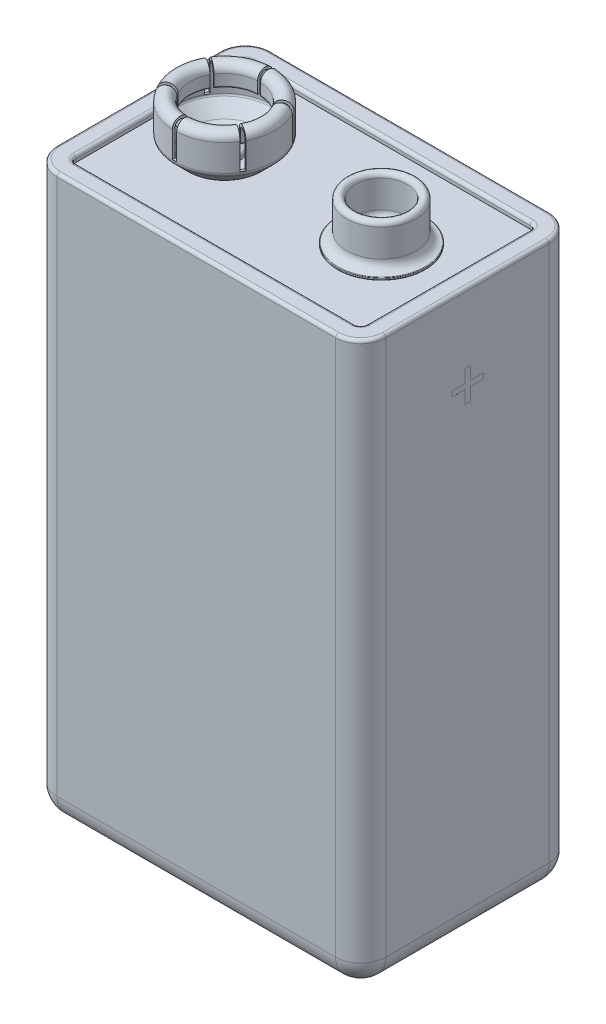
from build123d import *

# Parameters (mm, degrees)
GRUNDK_RPER_SKIZZE_W                          = 26.2
GRUNDK_RPER_SKIZZE_H                          = 17
GRUNDK_RPER_AUFSATZ_AUSTRAGEN_DEPTH           = 22.5
GRUNDK_RPER_VERRUNDUNG_R                      = 2
VERTIEFUNG_ANSCHL_SSE_SCHNITT_AUSTRAGEN_DEPTH = 0.5
VERTIEFUNG_ANSCHL_SSE_VERRUNDUNG_R            = 0.25
ANSCHLUSS_MINUSPOL_ROTATION_ANGLE             = 55
ANSCHLUSS_MINUSPOL_KREISMUSTER_COUNT          = 6
BESCHRIFTUNG_PLUSPOL_SCHNITT_AUSTRAGEN_DEPTH  = 0.001
BESCHRIFTUNG_MINUSPOL_SKIZZE_W                = 2.333333333
BESCHRIFTUNG_MINUSPOL_SKIZZE_H                = 0.358974358
BESCHRIFTUNG_MINUSPOL_SCHNITT_AUSTRAGEN_DEPTH = 0.001


with BuildPart() as part:
    # Grundkörper_Skizze → Grundkörper_Aufsatz austragen (new, symmetric)
    with BuildSketch(Plane(origin=(0, 0, 0), x_dir=(1, 0, 0), z_dir=(0, 1, 0))):
        Rectangle(GRUNDK_RPER_SKIZZE_W, GRUNDK_RPER_SKIZZE_H)
    extrude(amount=GRUNDK_RPER_AUFSATZ_AUSTRAGEN_DEPTH, both=True)

    # Grundkörper_Verrundung
    grundk_rper_verrundung_edges = [part.edges().sort_by_distance(p)[0] for p in [
        (0, -22.5, -8.5),
        (13.1, -22.5, 0),
        (0, -22.5, 8.5),
        (-13.1, -22.5, 0),
        (-13.1, 0, -8.5),
        (13.1, 0, -8.5),
        (13.1, 0, 8.5),
        (-13.1, 0, 8.5),
    ]]
    fillet(grundk_rper_verrundung_edges, radius=GRUNDK_RPER_VERRUNDUNG_R)

    # Vertiefung Anschlüsse_Skizze → Vertiefung Anschlüsse_Schnitt austragen (cut)
    with BuildSketch(Plane(origin=(0, 22.5, 0), x_dir=(1, 0, 0), z_dir=(0, 1, 0))):
        with BuildLine():
            Line((11.6, -6.5), (11.6, 6.5))
            ThreePointArc((11.6, 6.5), (11.453553391, 6.853553391), (11.1, 7))
            Line((11.1, 7), (-11.1, 7))
            ThreePointArc((-11.1, 7), (-11.453553391, 6.853553391), (-11.6, 6.5))
            Line((-11.6, 6.5), (-11.6, -6.5))
            ThreePointArc((-11.6, -6.5), (-11.453553391, -6.853553391), (-11.1, -7))
            Line((-11.1, -7), (11.1, -7))
            ThreePointArc((11.1, -7), (11.453553391, -6.853553391), (11.6, -6.5))
        make_face()
    extrude(amount=-VERTIEFUNG_ANSCHL_SSE_SCHNITT_AUSTRAGEN_DEPTH, mode=Mode.SUBTRACT)

    # Vertiefung Anschlüsse_Verrundung
    vertiefung_anschl_sse_verrundung_edges = [part.edges().sort_by_distance(p)[0] for p in [
        (0, 22.5, 8.5),
        (13.1, 22.5, 0),
        (0, 22.5, -8.5),
        (-13.1, 22.5, 0),
        (-12.514213562, 22.5, 7.914213562),
        (12.514213562, 22.5, 7.914213562),
        (-12.514213562, 22.5, -7.914213562),
        (12.514213562, 22.5, -7.914213562),
        (11.453553391, 22.5, 6.853553391),
        (11.6, 22.5, 0),
        (11.453553391, 22.5, -6.853553391),
        (0, 22.5, -7),
        (-11.453553391, 22.5, -6.853553391),
        (-11.6, 22.5, 0),
        (-11.453553391, 22.5, 6.853553391),
        (0, 22.5, 7),
    ]]
    fillet(vertiefung_anschl_sse_verrundung_edges, radius=VERTIEFUNG_ANSCHL_SSE_VERRUNDUNG_R)

    # Anschlüsse_Skizze → Anschluss Pluspol_Rotation (revolve)
    with BuildSketch(Plane.XY, mode=Mode.PRIVATE) as anschluss_pluspol_rotation_sk:
        with BuildLine():
            Line((9.75, 22.05), (9.75, 22.151564029))
            ThreePointArc((9.75, 22.151564029), (9.736443449, 22.185796689), (9.703125, 22.201466277))
            ThreePointArc((9.703125, 22.201466277), (9.20334826, 22.436510102), (9, 22.95))
            Line((9, 22.95), (9, 25.15))
            ThreePointArc((9, 25.15), (8.65, 25.5), (8.3, 25.15))
            Line((8.3, 25.15), (8.3, 22.95))
            ThreePointArc((8.3, 22.95), (8.153553391, 22.596446609), (7.8, 22.45))
            Line((7.8, 22.45), (7.5, 22.45))
            ThreePointArc((7.5, 22.45), (7.426776695, 22.626776695), (7.25, 22.7))
            Line((7.25, 22.7), (6.65, 22.7))
            ThreePointArc((6.65, 22.7), (6.473223305, 22.626776695), (6.4, 22.45))
            ThreePointArc((6.4, 22.45), (6.356066017, 22.343933983), (6.25, 22.3))
            Line((6.25, 22.3), (6.25, 22))
            Line((6.25, 22), (9.7, 22))
            ThreePointArc((9.7, 22), (9.735355339, 22.014644661), (9.75, 22.05))
        make_face()
    revolve(anschluss_pluspol_rotation_sk.sketch.rotate(Axis((6.25, 22, 0), (0, 1, 0)), 90), axis=Axis((6.25, 22, 0), (0, 1, 0)))

    # Anschluss Pluspol_Skizze<3> → Anschluss Minuspol Basis_Rotation (revolve)
    with BuildSketch(Plane.XY, mode=Mode.PRIVATE) as anschluss_minuspol_basis_rotation_sk:
        with BuildLine():
            Line((-7.5, 22.2), (-8.5, 22.2))
            ThreePointArc((-8.5, 22.2), (-8.806146746, 22.260896374), (-9.065685425, 22.434314575))
            Line((-9.065685425, 22.434314575), (-9.99246212, 23.36109127))
            ThreePointArc((-9.99246212, 23.36109127), (-10.035046392, 23.424823137), (-10.05, 23.5))
            Line((-10.05, 23.5), (-10.05, 23.55))
            Line((-10.05, 23.55), (-10.25, 23.55))
            Line((-10.25, 23.55), (-10.25, 23.5))
            ThreePointArc((-10.25, 23.5), (-10.219822299, 23.348286451), (-10.133883476, 23.219669914))
            Line((-10.133883476, 23.219669914), (-9.207106781, 22.292893219))
            ThreePointArc((-9.207106781, 22.292893219), (-8.882683432, 22.076120467), (-8.5, 22))
            Line((-8.5, 22), (-6.25, 22))
            Line((-6.25, 22), (-6.25, 22.3))
            ThreePointArc((-6.25, 22.3), (-6.356066017, 22.343933983), (-6.4, 22.45))
            ThreePointArc((-6.4, 22.45), (-6.473223305, 22.626776695), (-6.65, 22.7))
            Line((-6.65, 22.7), (-7.25, 22.7))
            ThreePointArc((-7.25, 22.7), (-7.426776695, 22.626776695), (-7.5, 22.45))
            Line((-7.5, 22.45), (-7.5, 22.2))
        make_face()
    revolve(anschluss_minuspol_basis_rotation_sk.sketch.rotate(Axis((-6.25, 22, 0), (0, 1, 0)), 270), axis=Axis((-6.25, 22, 0), (0, 1, 0)))


with BuildPart() as body_2:
    # Anschluss Minuspol_Skizze → Anschluss Minuspol_Rotation (revolve, symmetric)
    with BuildSketch(Plane.XY) as anschluss_minuspol_rotation_sk:
        with BuildLine():
            Line((-10.25, 23.55), (-10.05, 23.55))
            Line((-10.05, 23.55), (-10.05, 25.625))
            ThreePointArc((-10.05, 25.625), (-9.625, 26.05), (-9.2, 25.625))
            Line((-9.2, 25.625), (-9.2, 24.75))
            ThreePointArc((-9.2, 24.75), (-9.1, 24.65), (-9, 24.75))
            Line((-9, 24.75), (-9, 25.625))
            ThreePointArc((-9, 25.625), (-9.625, 26.25), (-10.25, 25.625))
            Line((-10.25, 25.625), (-10.25, 23.55))
        make_face()
    anschluss_minuspol_rotation = revolve(axis=Axis((-6.25, 25.625, 0), (0, 1, 0)), revolution_arc=ANSCHLUSS_MINUSPOL_ROTATION_ANGLE / 2)
    anschluss_minuspol_rotation = anschluss_minuspol_rotation + revolve(anschluss_minuspol_rotation_sk.sketch, axis=Axis((-6.25, 25.625, 0), (0, -1, 0)), revolution_arc=ANSCHLUSS_MINUSPOL_ROTATION_ANGLE / 2)


with BuildPart() as part_1:
    add(part.part)

    # Anschluss Minuspol_Kreismuster: Anschluss Minuspol_Rotation ×6 about axis
    anschluss_minuspol_kreismuster_axis = Axis((-6.25, 0, 0), (0, 1, 0))
    for i in range(1, ANSCHLUSS_MINUSPOL_KREISMUSTER_COUNT):
        add(anschluss_minuspol_rotation.rotate(anschluss_minuspol_kreismuster_axis, i * 360 / ANSCHLUSS_MINUSPOL_KREISMUSTER_COUNT))

    # Beschriftung Pluspol_Skizze → Beschriftung Pluspol_Schnitt austragen (cut)
    with BuildSketch(Plane(origin=(13.1, 0, 0), x_dir=(0, 0, -1), z_dir=(1, 0, 0))):
        Polygon((-0.179487179, 15.525641026), (-0.179487179, 14.493589744), (0.269230769, 14.493589744), (0.269230769, 15.525641026), (1.301282051, 15.525641026), (1.301282051, 15.929487179), (0.269230769, 15.929487179), (0.269230769, 16.961538462), (-0.179487179, 16.961538462), (-0.179487179, 15.929487179), (-1.211538462, 15.929487179), (-1.211538462, 15.525641026), align=None)
    extrude(amount=-BESCHRIFTUNG_PLUSPOL_SCHNITT_AUSTRAGEN_DEPTH, mode=Mode.SUBTRACT)

    # Beschriftung Minuspol_Skizze → Beschriftung Minuspol_Schnitt austragen (cut)
    with BuildSketch(Plane.ZY.offset(13.1)):
        with Locations((-0.022435898, 15.75)):
            Rectangle(BESCHRIFTUNG_MINUSPOL_SKIZZE_W, BESCHRIFTUNG_MINUSPOL_SKIZZE_H)
    extrude(amount=-BESCHRIFTUNG_MINUSPOL_SCHNITT_AUSTRAGEN_DEPTH, mode=Mode.SUBTRACT)


solid = Compound([body_2.part, part_1.part])
